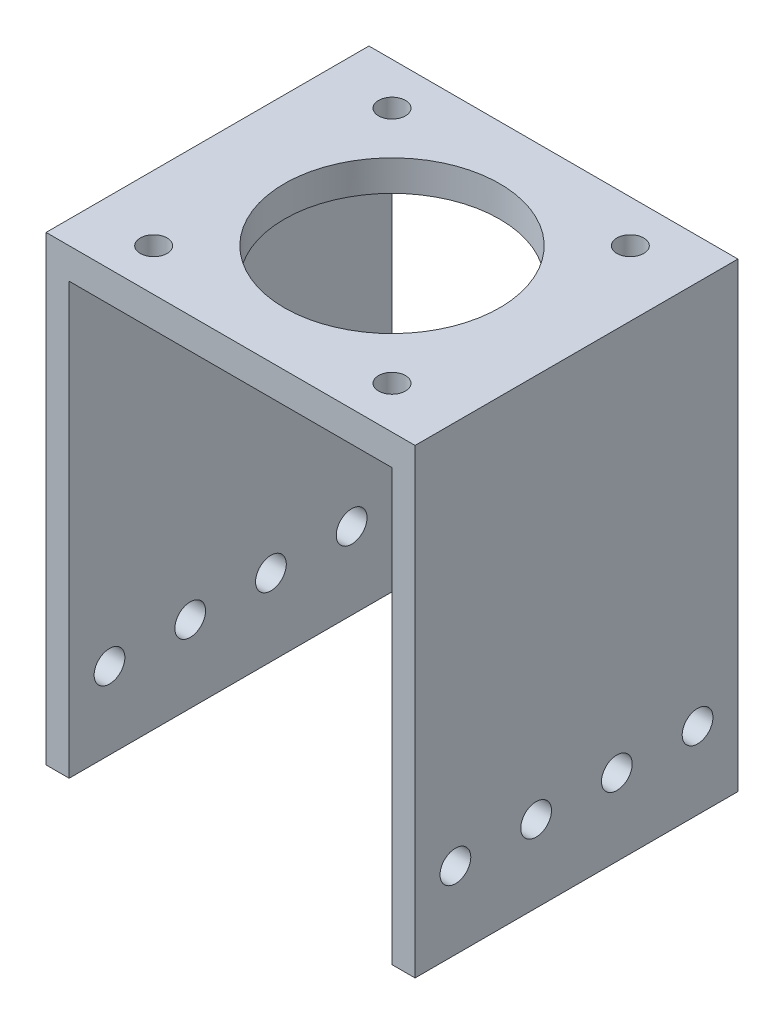
from build123d import *

# Parameters (mm, degrees)
BOSS_EXTRUDE1_DEPTH = 42
SKETCH2_R           = 1.75
SKETCH2_R_2         = 14
CUT_EXTRUDE1_DEPTH  = 78.071395472
SKETCH3_R           = 2
CUT_EXTRUDE2_DEPTH  = 71.484040747


with BuildPart() as part:
    # Sketch1 → Boss-Extrude1 (new body)
    with BuildSketch(Plane.XY):
        Polygon((-21, -30), (-21, 26), (21, 26), (21, -30), (24, -30), (24, 30), (-24, 30), (-24, -30), align=None)
    extrude(amount=BOSS_EXTRUDE1_DEPTH)

    # Sketch2 → Cut-Extrude1 (cut, through all)
    with BuildSketch(Plane(origin=(0, 30, 0), x_dir=(1, 0, 0), z_dir=(0, 1, 0))):
        with Locations((15.5, -36.5)):
            Circle(SKETCH2_R)
        with Locations((15.5, -5.5)):
            Circle(SKETCH2_R)
        with Locations((-15.5, -36.5)):
            Circle(SKETCH2_R)
        with Locations((-15.5, -5.5)):
            Circle(SKETCH2_R)
        with Locations((0, -21)):
            Circle(SKETCH2_R_2)
    extrude(amount=-CUT_EXTRUDE1_DEPTH, mode=Mode.SUBTRACT)

    # Sketch3 → Cut-Extrude2 (cut, through all)
    with BuildSketch(Plane(origin=(24, 0, 0), x_dir=(0, 0, -1), z_dir=(1, 0, 0))):
        with Locations((-15.75, -20)):
            Circle(SKETCH3_R)
        with Locations((-5.25, -20)):
            Circle(SKETCH3_R)
        with Locations((-36.75, -20)):
            Circle(SKETCH3_R)
        with Locations((-26.25, -20)):
            Circle(SKETCH3_R)
    extrude(amount=-CUT_EXTRUDE2_DEPTH, mode=Mode.SUBTRACT)


solid = part.part
